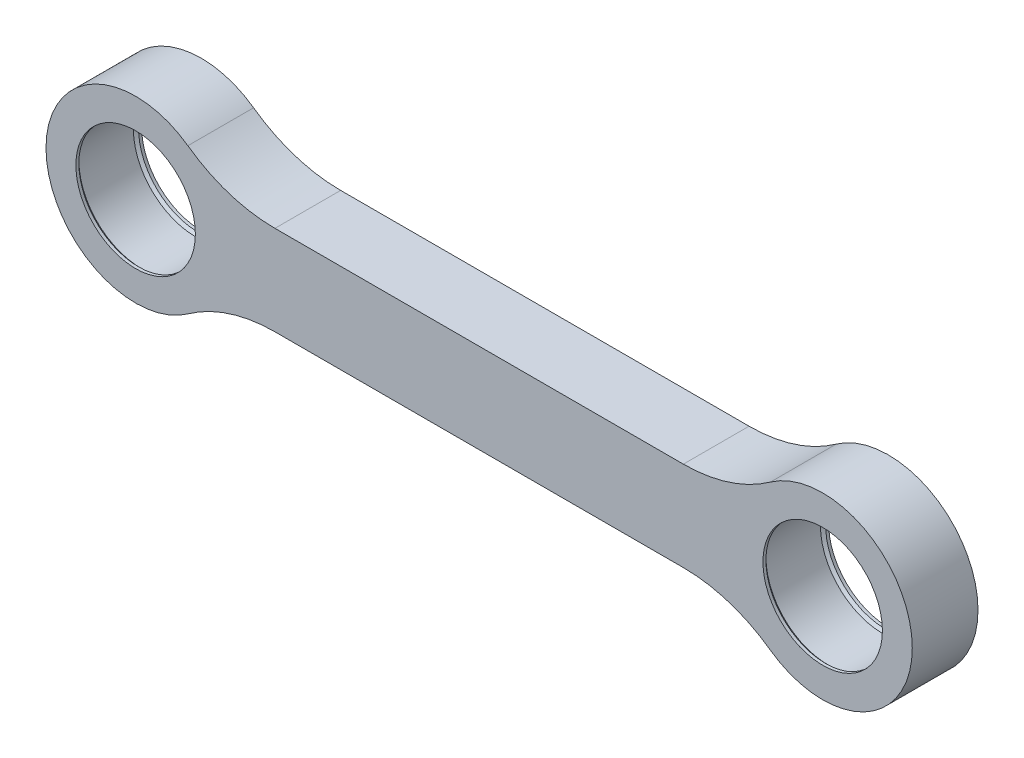
from build123d import *

# Parameters (mm, degrees)
EXTRUDE_1_DEPTH      = 4
EXTRUDE_1_DEPTH_BACK = 0.4
SKETCH_1_R           = 4
SKETCH_1_3_R         = 4.175
SKETCH_1_3_R_2       = 4
CUT_EXTRUDE_1_DEPTH  = 3.6
CHAMFER_1_SIZE       = 0.2
FILLET_1_R           = 10


with BuildPart() as part:
    # 草图1 → 凸台-拉伸1 (new, two sides: drawn at the far end of the back side and taken through both)
    with BuildSketch(Plane.XY.offset(-EXTRUDE_1_DEPTH_BACK)):
        with BuildLine():
            ThreePointArc((5.196152423, 3), (-6, 0), (5.196152423, -3))
            Line((5.196152423, -3), (40.803847577, -3))
            ThreePointArc((40.803847577, -3), (52, 0), (40.803847577, 3))
            Line((40.803847577, 3), (5.196152423, 3))
        make_face()
        Circle(SKETCH_1_R, mode=Mode.SUBTRACT)
        with Locations((46, 0)):
            Circle(SKETCH_1_R, mode=Mode.SUBTRACT)
    extrude(amount=EXTRUDE_1_DEPTH + EXTRUDE_1_DEPTH_BACK)

    # 草图1<3> → 切除-拉伸1 (cut)
    # profile 1 of 2: a face of its own
    with BuildSketch(Plane.XY):
        Circle(SKETCH_1_3_R)
        Circle(SKETCH_1_3_R_2, mode=Mode.SUBTRACT)
    # profile 2 of 2: a face of its own
    with BuildSketch(Plane.XY):
        with Locations((46, 0)):
            Circle(SKETCH_1_3_R)
        with Locations((46, 0)):
            Circle(SKETCH_1_3_R_2, mode=Mode.SUBTRACT)
    extrude(amount=CUT_EXTRUDE_1_DEPTH, mode=Mode.SUBTRACT)

    # 倒角1
    # the kernel refuses this chamfer: 0.2 mm, written as the material it takes off along each edge
    with BuildSketch(Plane(origin=(0, 0, 3.6), x_dir=(1, 0, 0), z_dir=(0, -1, 0))) as chamfer_1_piece_1_section:
        Polygon((4, CHAMFER_1_SIZE), (4 + CHAMFER_1_SIZE, 0), (4, 0), align=None)
    chamfer_1_piece_1 = revolve(axis=Axis((0, 0, 3.6), (0, 0, 1)), mode=Mode.PRIVATE)
    chamfer_1_piece_1 = chamfer_1_piece_1 & Plane(origin=(0, 0, 3.709543273), x_dir=(1, 0, 0), z_dir=(0, 0, -1)) * Cylinder(4.175, 17, mode=Mode.PRIVATE)
    add(chamfer_1_piece_1, mode=Mode.SUBTRACT)
    with BuildSketch(Plane(origin=(46, 0, 3.6), x_dir=(1, 0, 0), z_dir=(0, -1, 0))) as chamfer_1_piece_2_section:
        Polygon((4, CHAMFER_1_SIZE), (4 + CHAMFER_1_SIZE, 0), (4, 0), align=None)
    chamfer_1_piece_2 = revolve(axis=Axis((46, 0, 3.6), (0, 0, 1)), mode=Mode.PRIVATE)
    chamfer_1_piece_2 = chamfer_1_piece_2 & Plane(origin=(46, 0, 3.709543273), x_dir=(1, 0, 0), z_dir=(0, 0, -1)) * Cylinder(4.175, 17, mode=Mode.PRIVATE)
    add(chamfer_1_piece_2, mode=Mode.SUBTRACT)
    with BuildSketch(Plane(origin=(46, 0, 0), x_dir=(1, 0, 0), z_dir=(0, -1, 0))) as chamfer_1_piece_3_section:
        Polygon((4, -CHAMFER_1_SIZE), (4 + CHAMFER_1_SIZE, 0), (4, 0), align=None)
    chamfer_1_piece_3 = revolve(axis=Axis((46, 0, 0), (0, 0, 1)), mode=Mode.PRIVATE)
    chamfer_1_piece_3 = chamfer_1_piece_3 & Plane(origin=(46, 0, -0.109543273), x_dir=(1, 0, 0), z_dir=(0, 0, -1)) * Cylinder(4.175, 17, mode=Mode.PRIVATE)
    add(chamfer_1_piece_3, mode=Mode.SUBTRACT)
    with BuildSketch(Plane(origin=(0, 0, 0), x_dir=(1, 0, 0), z_dir=(0, -1, 0))) as chamfer_1_piece_4_section:
        Polygon((4, -CHAMFER_1_SIZE), (4 + CHAMFER_1_SIZE, 0), (4, 0), align=None)
    chamfer_1_piece_4 = revolve(axis=Axis((0, 0, 0), (0, 0, 1)), mode=Mode.PRIVATE)
    chamfer_1_piece_4 = chamfer_1_piece_4 & Plane(origin=(0, 0, -0.109543273), x_dir=(1, 0, 0), z_dir=(0, 0, -1)) * Cylinder(4.175, 17, mode=Mode.PRIVATE)
    add(chamfer_1_piece_4, mode=Mode.SUBTRACT)

    # 圆角1
    fillet_1_edges = [part.edges().sort_by_distance(p)[0] for p in [
        (5.196152423, -3, 1.8),
        (5.196152423, 3, 1.8),
        (40.803847577, 3, 1.8),
        (40.803847577, -3, 1.8),
    ]]
    fillet(fillet_1_edges, radius=FILLET_1_R)


solid = part.part
